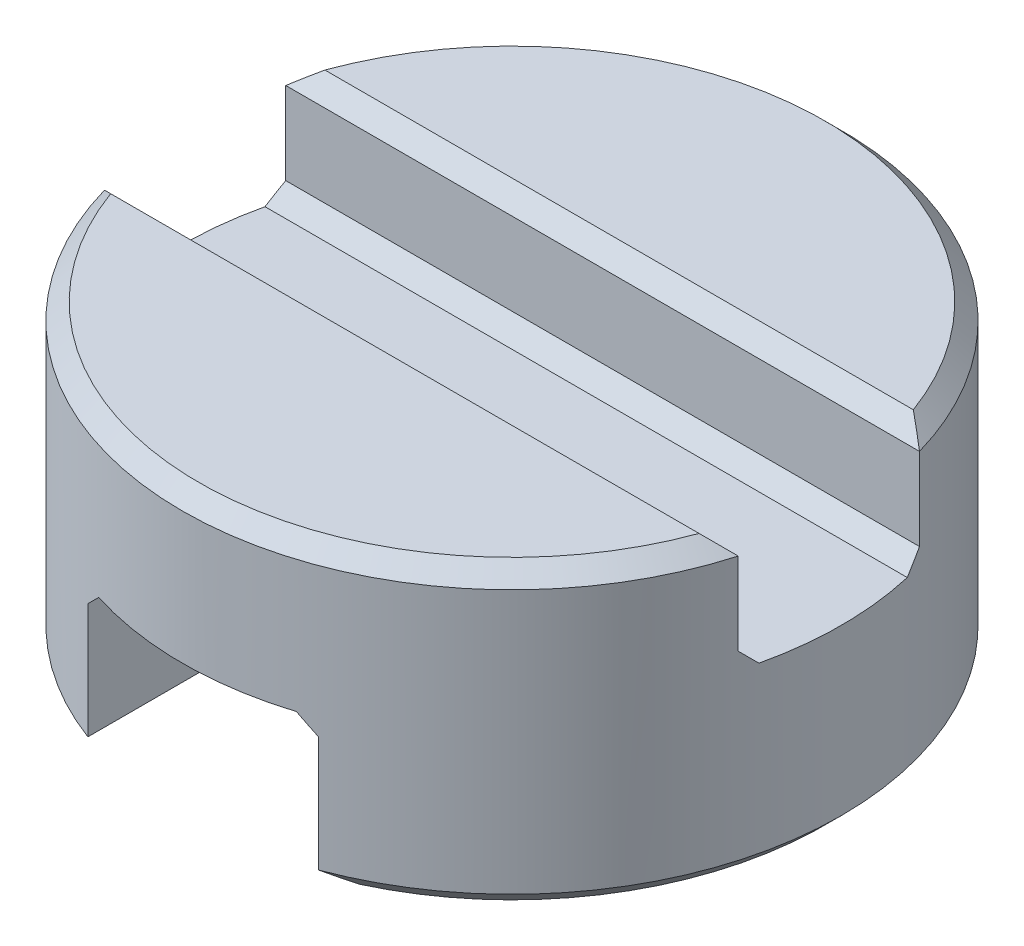
from build123d import *

# Parameters (mm, degrees)
SKETCH_1_R          = 10
EXTRUDE_1_DEPTH     = 9
SKETCH_2_W          = 7
SKETCH_2_H          = 20
CUT_EXTRUDE_1_DEPTH = 4.5
CHAMFER_1_SIZE      = 0.5
SKETCH_3_W          = 22
SKETCH_3_H          = 5.5
CUT_EXTRUDE_2_DEPTH = 3.5
CHAMFER_2_SIZE      = 0.5


with BuildPart() as part:
    # Эскиз1 → Бобышка-Вытянуть1 (new body)
    with BuildSketch(Plane(origin=(0, 0, 0), x_dir=(1, 0, 0), z_dir=(0, 1, 0))):
        Circle(SKETCH_1_R)
    extrude(amount=EXTRUDE_1_DEPTH)

    # Эскиз2 → Вырез-Вытянуть1 (cut)
    with BuildSketch(Plane.XZ):
        Rectangle(SKETCH_2_W, SKETCH_2_H)
    extrude(amount=-CUT_EXTRUDE_1_DEPTH, mode=Mode.SUBTRACT)

    # Фаска1
    chamfer_1_edges = [part.edges().sort_by_distance(p)[0] for p in [
        (-10, 0, 0),
        (-3.5, 0, 0),
        (8.215838363, 0, -5.700877125),
        (3.5, 0, 0),
        (-3.5, 4.5, 0),
        (3.5, 4.5, 0),
    ]]
    chamfer(chamfer_1_edges, length=CHAMFER_1_SIZE)

    # Эскиз3 → Вырез-Вытянуть2 (cut)
    with BuildSketch(Plane(origin=(0, 9, 0), x_dir=(1, 0, 0), z_dir=(0, 1, 0))):
        Rectangle(SKETCH_3_W, SKETCH_3_H)
    extrude(amount=-CUT_EXTRUDE_2_DEPTH, mode=Mode.SUBTRACT)

    # Фаска2
    chamfer_2_edges = [part.edges().sort_by_distance(p)[0] for p in [
        (0, 9, 10),
        (0, 9, 2.75),
        (0, 9, -10),
        (0, 9, -2.75),
        (0, 5.5, 2.75),
        (0, 5.5, -2.75),
    ]]
    chamfer(chamfer_2_edges, length=CHAMFER_2_SIZE)


solid = part.part
